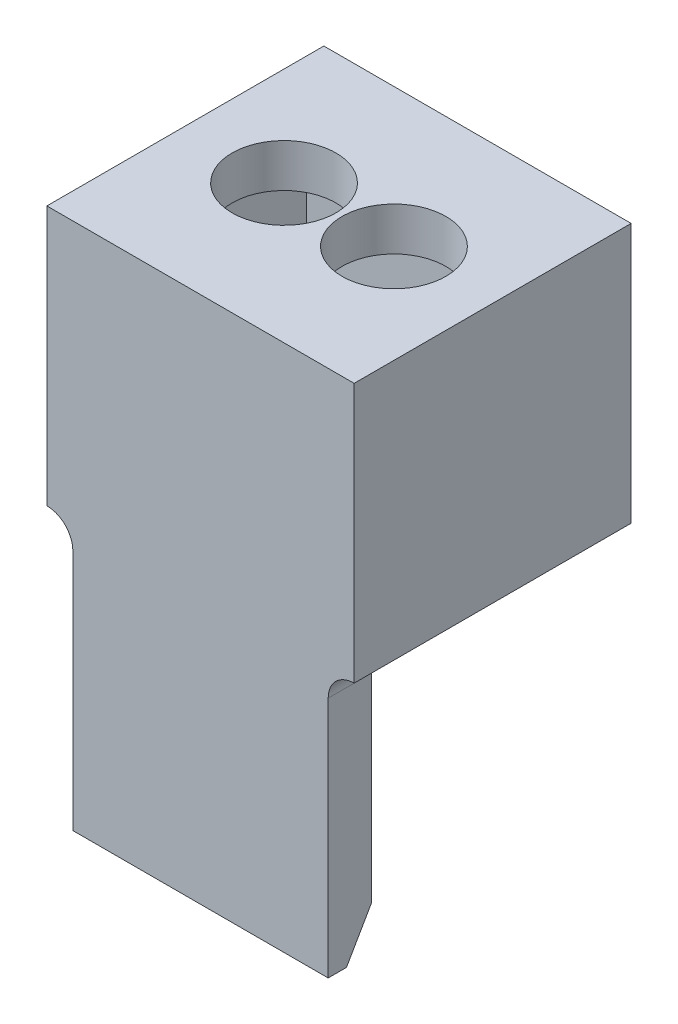
from build123d import *

# Parameters (mm, degrees)
SKETCH1_W           = 2.95
SKETCH1_H           = 5.6
BOSS_EXTRUDE1_DEPTH = 0.5
SKETCH2_W           = 3.2
SKETCH2_H           = 2.5
BOSS_EXTRUDE2_DEPTH = 0.3
SKETCH3_W           = 0.5
SKETCH3_H           = 2.5
BOSS_EXTRUDE3_DEPTH = 1.475
SKETCH4_W           = 1.775
SKETCH4_H           = 3.2
SKETCH4_R           = 0.6
BOSS_EXTRUDE4_DEPTH = 0.5
CHAMFER1_SIZE       = 0.5
CHAMFER1_SIZE2      = 0.288675135
FILLET1_R           = 0.3


with BuildPart() as part:
    # Sketch1 → Boss-Extrude1 (new body)
    with BuildSketch(Plane.XY.offset(2.859564597)):
        with Locations((9.900211803, 12.722346538)):
            Rectangle(SKETCH1_W, SKETCH1_H)
    extrude(amount=BOSS_EXTRUDE1_DEPTH)

    # Sketch2 → Boss-Extrude2 (add)
    with BuildSketch(Plane(origin=(11.375211803, 0, 0), x_dir=(0, 0, -1), z_dir=(1, 0, 0))):
        with Locations((-1.759564597, 14.272346538)):
            Rectangle(SKETCH2_W, SKETCH2_H)
    boss_extrude2 = extrude(amount=BOSS_EXTRUDE2_DEPTH)

    # Sketch3 → Boss-Extrude3 (add)
    with BuildSketch(Plane.ZY.offset(-11.375211803)):
        with Locations((0.409564597, 14.272346538)):
            Rectangle(SKETCH3_W, SKETCH3_H)
    boss_extrude3 = extrude(amount=BOSS_EXTRUDE3_DEPTH)

    # Sketch4 → Boss-Extrude4 (add)
    with BuildSketch(Plane(origin=(0, 15.522346538, 0), x_dir=(1, 0, 0), z_dir=(0, 1, 0))):
        with Locations((10.787711803, -1.759564597)):
            Rectangle(SKETCH4_W, SKETCH4_H)
        with Locations(Location((10.535211803, -1.759564597, 0), (0, 0, 270))):
            Circle(SKETCH4_R, mode=Mode.SUBTRACT)
    boss_extrude4 = extrude(amount=BOSS_EXTRUDE4_DEPTH)

    # Mirror1: Boss-Extrude2, Boss-Extrude3, Boss-Extrude4 across plane
    add(boss_extrude2.mirror(Plane(origin=(9.900211803, 0, 0), x_dir=(0, 0, 1), z_dir=(1, 0, 0))))
    add(boss_extrude3.mirror(Plane(origin=(9.900211803, 0, 0), x_dir=(0, 0, 1), z_dir=(1, 0, 0))))
    add(boss_extrude4.mirror(Plane(origin=(9.900211803, 0, 0), x_dir=(0, 0, 1), z_dir=(1, 0, 0))))

    # Chamfer1
    chamfer1_edges = [part.edges().sort_by_distance(p)[0] for p in [
        (9.900211803, 9.922346538, 2.859564597),
    ]]
    chamfer1_side = [part.faces().sort_by_distance(p)[0] for p in [
        (9.900211803, 12.722346538, 2.859564597),
    ]]
    chamfer(chamfer1_edges, length=CHAMFER1_SIZE, length2=CHAMFER1_SIZE2, reference=chamfer1_side[0])

    # Fillet1
    fillet1_edges = [part.edges().sort_by_distance(p)[0] for p in [
        (11.375211803, 13.022346538, 3.109564597),
        (8.425211803, 13.022346538, 3.109564597),
    ]]
    fillet(fillet1_edges, radius=FILLET1_R - 0.0001)  # a hair under: the kernel refuses the full size


solid = part.part
